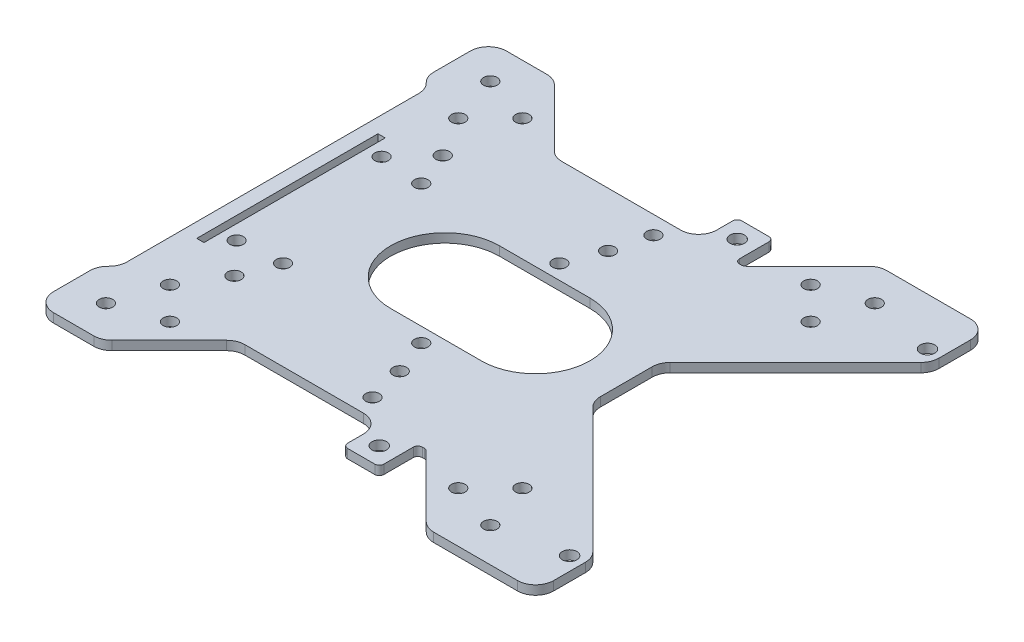
from build123d import *

# Parameters (mm, degrees)
SKETCH_1_W          = 120
SKETCH_1_H          = 100
EXTRUDE_1_DEPTH     = 2
SKETCH_2_R          = 1.6
SKETCH_2_R_2        = 1.5
CUT_EXTRUDE_1_DEPTH = 79.128099938
SKETCH_3_R          = 1.5
CUT_EXTRUDE_2_DEPTH = 79.128099938
CUT_EXTRUDE_4_DEPTH = 79.128099938
FILLET_1_R          = 1
FILLET_2_R          = 4
SKETCH_6_W          = 26.898582276
SKETCH_6_H          = 125.784737262
CUT_EXTRUDE_5_DEPTH = 79.128099938
FILLET_3_R          = 4
CUT_EXTRUDE_6_DEPTH = 79.128099938
SKETCH_8_W          = 1.6
SKETCH_8_H          = 40
CUT_EXTRUDE_7_DEPTH = 79.128099938
SKETCH_9_R          = 1.5
CUT_EXTRUDE_8_DEPTH = 79.128099938


with BuildPart() as part:
    # 草图1 → 凸台-拉伸1 (new body)
    with BuildSketch(Plane(origin=(0, 0, 0), x_dir=(1, 0, 0), z_dir=(0, 1, 0))):
        Rectangle(SKETCH_1_W, SKETCH_1_H)
    extrude(amount=EXTRUDE_1_DEPTH)

    # 草图2 → 切除-拉伸1 (cut, through all)
    with BuildSketch(Plane(origin=(0, 2, 0), x_dir=(1, 0, 0), z_dir=(0, 1, 0))):
        with Locations((15, 39.5)):
            Circle(SKETCH_2_R)
        with Locations((57, 39.5)):
            Circle(SKETCH_2_R)
        with Locations((57, -39.5)):
            Circle(SKETCH_2_R)
        with Locations((15, -39.5)):
            Circle(SKETCH_2_R)
        with Locations((-30.5, 15.25)):
            Circle(SKETCH_2_R_2)
        with Locations((-30.5, -15.25)):
            Circle(SKETCH_2_R_2)
        with Locations((0, -15.25)):
            Circle(SKETCH_2_R_2)
        with Locations((0, 15.25)):
            Circle(SKETCH_2_R_2)
        with Locations((3, 23)):
            Circle(SKETCH_2_R_2)
        with Locations((-33.5, 23)):
            Circle(SKETCH_2_R_2)
        with Locations((-33.5, -23)):
            Circle(SKETCH_2_R_2)
        with Locations((3, -23)):
            Circle(SKETCH_2_R_2)
    extrude(amount=-CUT_EXTRUDE_1_DEPTH, mode=Mode.SUBTRACT)

    # 草图3 → 切除-拉伸2 (cut, through all)
    with BuildSketch(Plane(origin=(0, 2, 0), x_dir=(1, 0, 0), z_dir=(0, 1, 0))):
        with Locations((-42.426406871, 42.426406871)):
            Circle(SKETCH_3_R)
        with Locations((-31.819805153, 38.890872965)):
            Circle(SKETCH_3_R)
        with Locations((-38.890872965, 31.819805153)):
            Circle(SKETCH_3_R)
        with Locations((-31.819805153, -38.890872965)):
            Circle(SKETCH_3_R)
        with Locations((-38.890872965, -31.819805153)):
            Circle(SKETCH_3_R)
        with Locations((-42.426406871, -42.426406871)):
            Circle(SKETCH_3_R)
        with Locations((31.819805153, 38.890872965)):
            Circle(SKETCH_3_R)
        with Locations((38.890872965, 31.819805153)):
            Circle(SKETCH_3_R)
        with Locations((42.426406871, 42.426406871)):
            Circle(SKETCH_3_R)
        with Locations((31.819805153, -38.890872965)):
            Circle(SKETCH_3_R)
        with Locations((42.426406871, -42.426406871)):
            Circle(SKETCH_3_R)
        with Locations((38.890872965, -31.819805153)):
            Circle(SKETCH_3_R)
    extrude(amount=-CUT_EXTRUDE_2_DEPTH, mode=Mode.SUBTRACT)

    # 草图4 → 切除-拉伸4 (cut, through all)
    with BuildSketch(Plane(origin=(0, 2, 0), x_dir=(1, 0, 0), z_dir=(0, 1, 0))):
        Polygon((-60, 45.857864376), (-48, 33.857864376), (-48, -33.857864376), (-60, -45.857864376), align=None)
        Polygon((-35.857864376, -50), (-20.857864376, -35), (11, -35), (11, -43.5), (19, -43.5), (19, -35), (20.857864376, -35), (35.857864376, -50), align=None)
        Polygon((35.857864376, 50), (-35.857864376, 50), (-20.857864376, 35), (11, 35), (11, 43.5), (19, 43.5), (19, 35), (20.857864376, 35), align=None)
        Polygon((60, -37.372583002), (30, -7.372583002), (30, 7.372583002), (60, 37.372583002), align=None)
    extrude(amount=-CUT_EXTRUDE_4_DEPTH, mode=Mode.SUBTRACT)

    # 圆角1
    fillet_1_edges = [part.edges().sort_by_distance(p)[0] for p in [
        (20.857864376, 1, 35),
        (19, 1, 35),
        (19, 1, 43.5),
        (11, 1, 43.5),
        (20.857864376, 1, -35),
        (19, 1, -35),
        (11, 1, -43.5),
        (19, 1, -43.5),
    ]]
    fillet(fillet_1_edges, radius=FILLET_1_R)

    # 圆角2
    fillet_2_edges = [part.edges().sort_by_distance(p)[0] for p in [
        (30, 1, 7.372583002),
        (30, 1, -7.372583002),
        (-48, 1, -33.857864376),
        (-48, 1, 33.857864376),
        (-20.857864376, 1, 35),
        (-20.857864376, 1, -35),
        (11, 1, 35),
        (11, 1, -35),
    ]]
    fillet(fillet_2_edges, radius=FILLET_2_R)

    # 草图6 → 切除-拉伸5 (cut, through all)
    with BuildSketch(Plane(origin=(0, 2, 0), x_dir=(1, 0, 0), z_dir=(0, 1, 0))):
        with Locations((-63.875698009, -2.031907294)):
            Rectangle(SKETCH_6_W, SKETCH_6_H)
    extrude(amount=-CUT_EXTRUDE_5_DEPTH, mode=Mode.SUBTRACT)

    # 圆角3
    fillet_3_edges = [part.edges().sort_by_distance(p)[0] for p in [
        (-35.857864376, 1, 50),
        (-50.426406871, 1, 36.284271247),
        (-50.426406871, 1, 50),
        (35.857864376, 1, 50),
        (60, 1, 50),
        (60, 1, 37.372583002),
        (60, 1, -37.372583002),
        (60, 1, -50),
        (35.857864376, 1, -50),
        (-35.857864376, 1, -50),
        (-50.426406871, 1, -36.284271247),
        (-50.426406871, 1, -50),
    ]]
    fillet(fillet_3_edges, radius=FILLET_3_R)

    # 草图7 → 切除-拉伸6 (cut, through all)
    with BuildSketch(Plane(origin=(0, 2, 0), x_dir=(1, 0, 0), z_dir=(0, 1, 0))):
        with BuildLine():
            Line((-10, 12), (10, 12))
            ThreePointArc((10, 12), (22, 0), (10, -12))
            Line((10, -12), (-10, -12))
            ThreePointArc((-10, -12), (-22, 0), (-10, 12))
        make_face()
    extrude(amount=-CUT_EXTRUDE_6_DEPTH, mode=Mode.SUBTRACT)

    # 草图8 → 切除-拉伸7 (cut, through all)
    with BuildSketch(Plane(origin=(0, 2, 0), x_dir=(1, 0, 0), z_dir=(0, 1, 0))):
        with Locations((-44, 0)):
            Rectangle(SKETCH_8_W, SKETCH_8_H)
    extrude(amount=-CUT_EXTRUDE_7_DEPTH, mode=Mode.SUBTRACT)

    # 草图9 → 切除-拉伸8 (cut, through all)
    with BuildSketch(Plane(origin=(0, 2, 0), x_dir=(1, 0, 0), z_dir=(0, 1, 0))):
        with Locations((-40, 16)):
            Circle(SKETCH_9_R)
        with Locations((5, 31)):
            Circle(SKETCH_9_R)
        with Locations((5, -31)):
            Circle(SKETCH_9_R)
        with Locations((-40, -16)):
            Circle(SKETCH_9_R)
    extrude(amount=-CUT_EXTRUDE_8_DEPTH, mode=Mode.SUBTRACT)


solid = part.part
